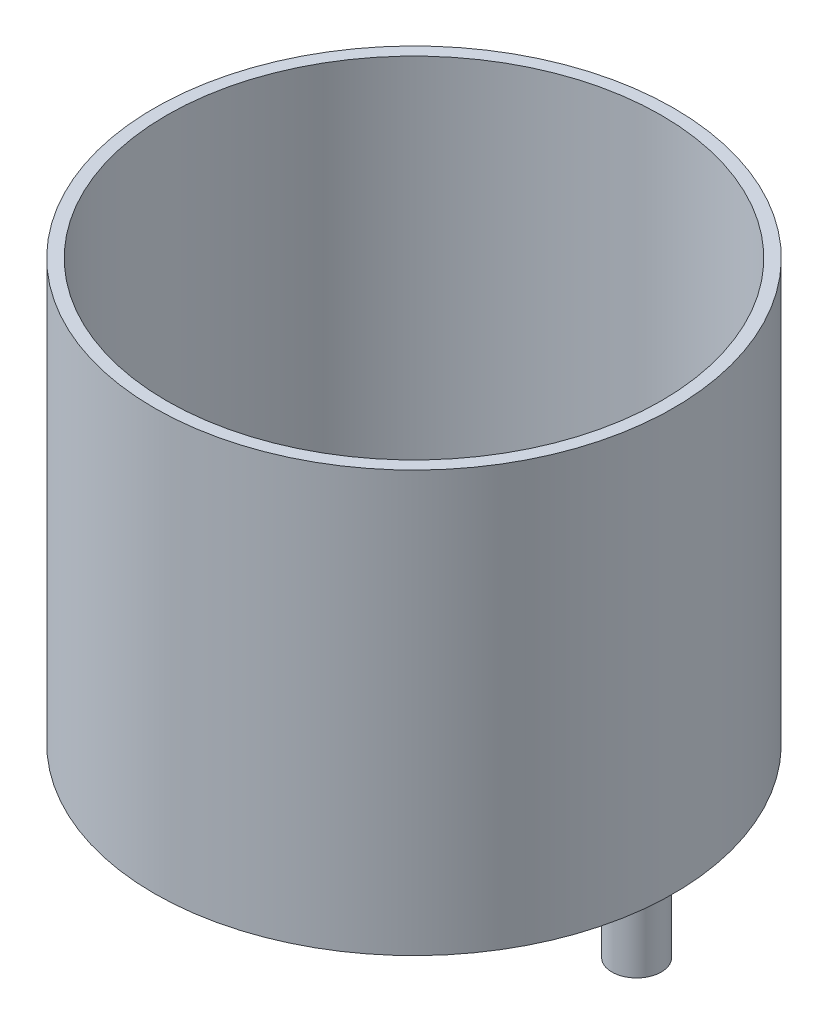
from build123d import *

# Parameters (mm, degrees)
CUT_EXTRUDE2_REACH  = 227.721
MOTOR_HOLE_R        = 12.5
STABLIZING_POLES_R  = 10
BOSS_EXTRUDE1_DEPTH = 30


with BuildPart() as part:
    # Compartment → Revolve1 (revolve)
    with BuildSketch(Plane.XY):
        Polygon((105, -80), (0, -80), (0, -75), (100, -75), (100, 90), (105, 90), align=None)
    revolve(axis=Axis((0, 0, 0), (0, 1, 0)))

    # Motor Hole → Cut-Extrude2 (cut, up to next)
    with BuildSketch(Plane.XZ.offset(80), mode=Mode.PRIVATE) as cut_extrude2_sk1:
        Circle(MOTOR_HOLE_R)
    cut_extrude2_tool1 = extrude(cut_extrude2_sk1.sketch, amount=-CUT_EXTRUDE2_REACH, mode=Mode.PRIVATE) & part.part
    add(cut_extrude2_tool1.solids().sort_by_distance((0, -80, 0))[0], mode=Mode.SUBTRACT)

    # Stablizing poles → Boss-Extrude1 (add)
    with BuildSketch(Plane.XZ.offset(80)):
        with Locations((-90, 0)):
            Circle(STABLIZING_POLES_R)
        with Locations((90, 0)):
            Circle(STABLIZING_POLES_R)
    extrude(amount=BOSS_EXTRUDE1_DEPTH)


solid = part.part
